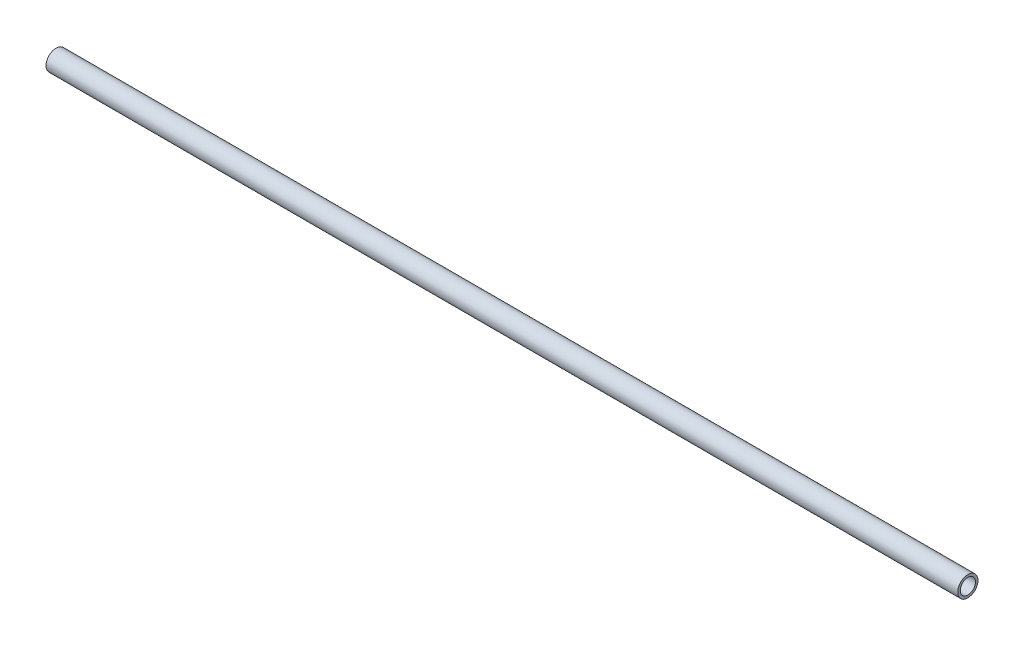
from build123d import *

# Parameters (mm, degrees)
SKETCH1_R           = 1
SKETCH1_R_2         = 0.75
BOSS_EXTRUDE1_DEPTH = 90
SKETCH3_R           = 0.396875
CUT_EXTRUDE2_DEPTH  = 10


with BuildPart() as part:
    # Sketch1 → Boss-Extrude1 (new body)
    with BuildSketch(Plane(origin=(0, 0, 0), x_dir=(0, 0, -1), z_dir=(1, 0, 0))):
        Circle(SKETCH1_R)
        Circle(SKETCH1_R_2, mode=Mode.SUBTRACT)
    extrude(amount=BOSS_EXTRUDE1_DEPTH)

    # Sketch3 → Cut-Extrude2 (cut)
    with BuildSketch(Plane.XY):
        with Locations((0.798611036, 0)):
            Circle(SKETCH3_R)
    extrude(amount=-CUT_EXTRUDE2_DEPTH, mode=Mode.SUBTRACT)


solid = part.part
